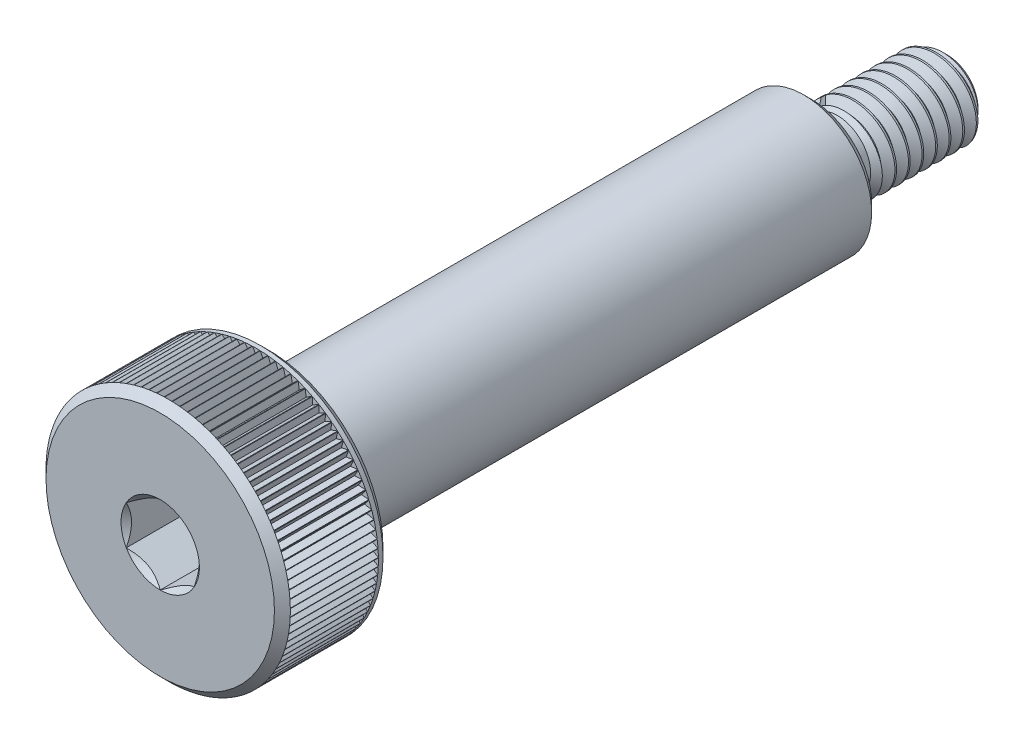
from build123d import *

# Parameters (mm, degrees)
CUT_EXTRUDE1_START     = 14.5
CUT_EXTRUDE1_DEPTH     = 2
CHAMFER1_SIZE          = 0.2925
CUT_SWEEP1_PITCH       = 0.5
CUT_SWEEP1_HEIGHT      = 4.05
CUT_SWEEP1_RADIUS      = 1.5
CUT_SWEEP1_START_ANGLE = 90
CUT_EXTRUDE3_START     = 14.2075
CUT_EXTRUDE3_DEPTH     = 3.24425
CIRPATTERN1_COUNT      = 99


with BuildPart() as part:
    # Sketch3 → Revolve1 (revolve)
    with BuildSketch(Plane(origin=(0, 0, 0), x_dir=(0, 0, -1), z_dir=(1, 0, 0)), mode=Mode.PRIVATE) as revolve1_sk:
        with BuildLine():
            Line((-14.5, 0), (-14.5, 4.2075))
            Line((-14.5, 4.2075), (-14.2075, 4.5))
            Line((-14.2075, 4.5), (-10.7925, 4.5))
            Line((-10.7925, 4.5), (-10.5, 4.2075))
            Line((-10.5, 4.2075), (-10.5, 2.297))
            Line((-10.5, 2.297), (-9.992, 2.297))
            Line((-9.992, 2.297), (-9.789, 2.5))
            Line((-9.789, 2.5), (9.5, 2.5))
            Line((9.5, 2.5), (9.5, 1.359375))
            ThreePointArc((9.5, 1.359375), (9.541188109, 1.259938109), (9.640625, 1.21875))
            Line((9.640625, 1.21875), (10.45, 1.21875))
            Line((10.45, 1.21875), (10.73125, 1.5))
            Line((10.73125, 1.5), (14.125, 1.5))
            Line((14.125, 1.5), (14.5, 1.125))
            Line((14.5, 1.125), (14.5, 0))
            Line((14.5, 0), (-14.5, 0))
        make_face()
    revolve(revolve1_sk.sketch.rotate(Axis((0, 0, 14.5), (0, 0, -1)), 90), axis=Axis((0, 0, 14.5), (0, 0, -1)))

    # Sketch4 → Cut-Extrude1 (cut)
    with BuildSketch(Plane.XY.offset(CUT_EXTRUDE1_START)):
        Polygon((0, 1.443375673), (-1.25, 0.721687836), (-1.25, -0.721687836), (0, -1.443375673), (1.25, -0.721687836), (1.25, 0.721687836), align=None)
    extrude(amount=-CUT_EXTRUDE1_DEPTH, mode=Mode.SUBTRACT)

    # Cut-Extrude2 cone 1 section (through the dimple's axis) → Cut-Extrude2 (revolve, cut)
    with BuildSketch(Plane(origin=(0, 0, 14.5), x_dir=(0, -1, 0), z_dir=(1, 0, 0))):
        Polygon((0, 0), (1.443375673, 0), (0, 1.443375673), align=None)
    revolve(axis=Axis((0, 0, 14.5), (0, 0, -1)), mode=Mode.SUBTRACT)

    # Chamfer1
    chamfer1_edges = [part.edges().sort_by_distance(p)[0] for p in [
        (-2.5, 0, -9.5),
    ]]
    chamfer(chamfer1_edges, length=CHAMFER1_SIZE)

    # Cut-Sweep1: sweep along a helix
    with BuildLine() as cut_sweep1_path:
        add(Helix(CUT_SWEEP1_PITCH, CUT_SWEEP1_HEIGHT, CUT_SWEEP1_RADIUS, center=(0, 0, -14.5), direction=(0, 0, 1), mode=Mode.PRIVATE).rotate(Axis((0, 0, -14.5), (0, 0, 1)), CUT_SWEEP1_START_ANGLE))
    # Sketch7 → Cut-Sweep1 (sweep, cut)
    with BuildSketch(Plane(origin=(0, 0, 0), x_dir=(0, 0, -1), z_dir=(1, 0, 0))):
        Polygon((14.484375, 1.527063294), (14.6875, 1.175240474), (14.75, 1.175240474), (14.953125, 1.527063294), align=None)
    sweep(path=cut_sweep1_path.line, is_frenet=True, mode=Mode.SUBTRACT)

    # Sketch8 → Cut-Extrude3 (cut)
    with BuildSketch(Plane.XY.offset(CUT_EXTRUDE3_START)):
        Polygon((-0.135099963, 4.5), (0.135099963, 4.5), (0, 4.266), align=None)
    cut_extrude3 = extrude(amount=-CUT_EXTRUDE3_DEPTH, mode=Mode.SUBTRACT)

    # CirPattern1: Cut-Extrude3 ×99 about axis
    cirpattern1_axis = Axis((0, 0, 0), (0, 0, 1))
    for i in range(1, CIRPATTERN1_COUNT):
        add(cut_extrude3.rotate(cirpattern1_axis, i * 360 / CIRPATTERN1_COUNT), mode=Mode.SUBTRACT)


solid = part.part
